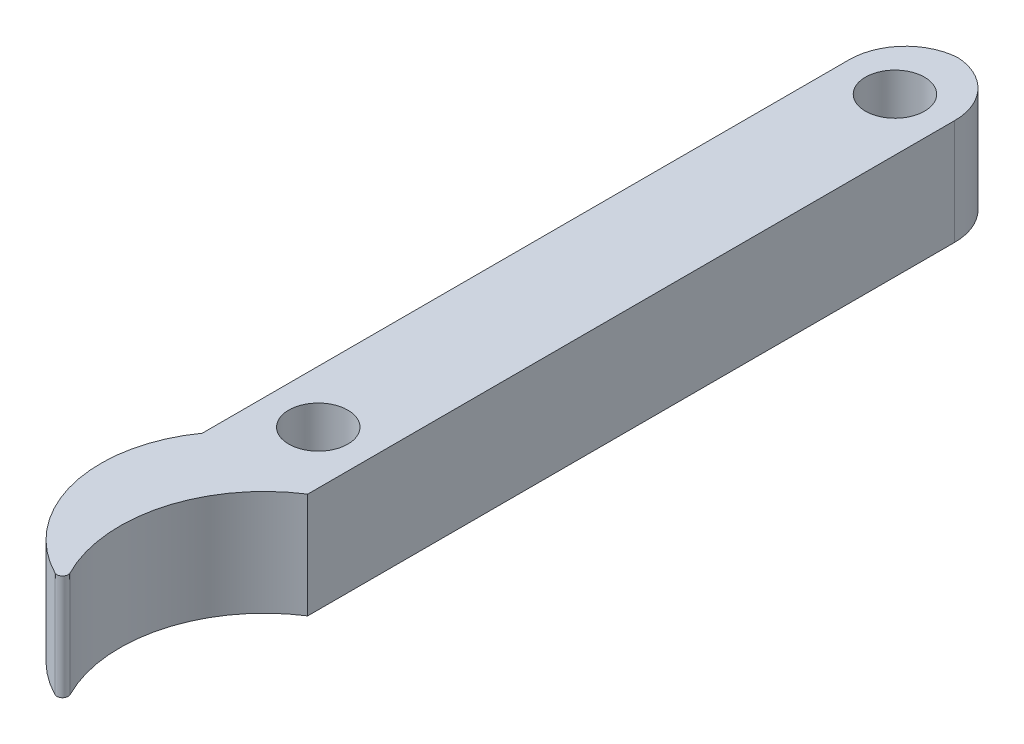
from build123d import *

# Parameters (mm, degrees)
SKETCH1_R           = 2.667
BOSS_EXTRUDE1_DEPTH = 9.525
FILLET1_R           = 5.08
FILLET2_R           = 0.508


with BuildPart() as part:
    # Sketch1 → Boss-Extrude1 (new body)
    with BuildSketch(Plane(origin=(0, 0, 0), x_dir=(1, 0, 0), z_dir=(0, 1, 0))):
        with BuildLine():
            Line((-4.7625, 31.75), (4.7625, 31.75))
            Line((4.7625, 31.75), (4.7625, -31.75))
            ThreePointArc((4.7625, -31.75), (-0.950597142, -40.049292778), (0.9525, -49.943531548))
            ThreePointArc((0.9525, -49.943531548), (-6.432834073, -42.269060926), (-4.7625, -31.75))
            Line((-4.7625, -31.75), (-4.7625, 31.75))
        make_face()
        with Locations(Location((0, -26.035, 0), (0, 0, 90))):
            Circle(SKETCH1_R, mode=Mode.SUBTRACT)
        with Locations(Location((0, 26.035, 0), (0, 0, 90))):
            Circle(SKETCH1_R, mode=Mode.SUBTRACT)
    extrude(amount=BOSS_EXTRUDE1_DEPTH)

    # Fillet1
    # the kernel refuses this fillet: 5.08 mm, written as the material it takes off along each edge
    with BuildSketch(Plane(origin=(-4.7625, -12.7, -31.75), x_dir=(0, 0, 1), z_dir=(0, 1, 0)), Plane(origin=(4.7625, -12.7, -31.75), x_dir=(-1, 0, 0), z_dir=(0, 1, 0))) as fillet1_piece_1:
        with BuildLine():
            CenterArc((FILLET1_R, FILLET1_R), FILLET1_R, 180, 90)
            Line((0, FILLET1_R), (0, 0))
            Line((0, 0), (FILLET1_R, 0))
        make_face()
    extrude(amount=34.925, mode=Mode.SUBTRACT)

    # Fillet2
    fillet2_edges = [part.edges().sort_by_distance(p)[0] for p in [
        (0.9525, 4.7625, 49.943531548),
    ]]
    fillet(fillet2_edges, radius=FILLET2_R)


solid = part.part
